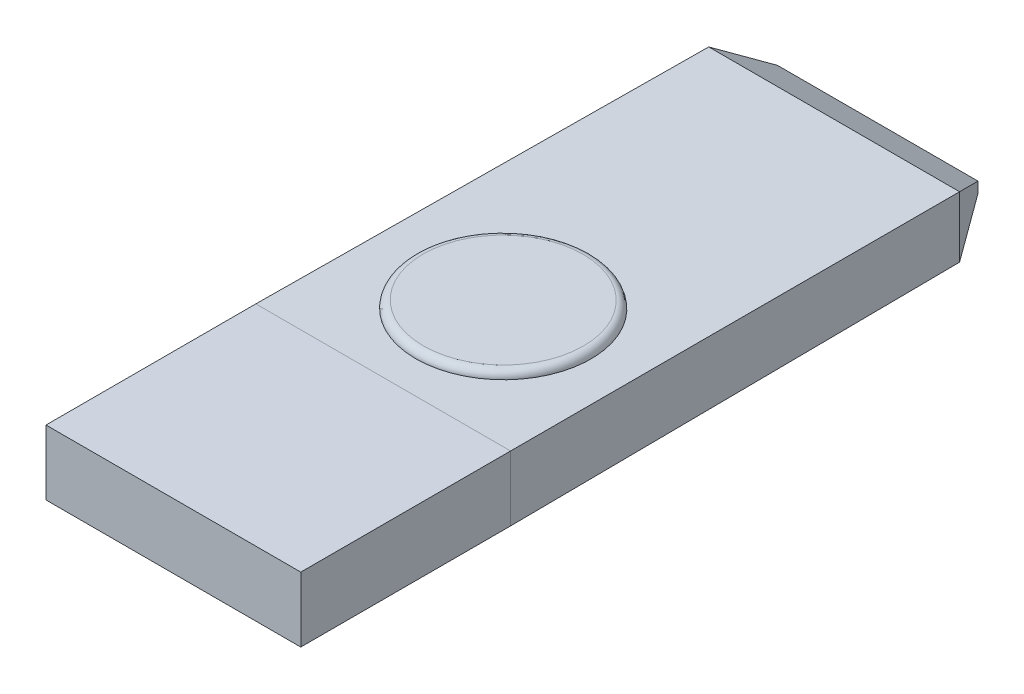
from build123d import *

# Parameters (mm, degrees)
SHIM_TOP_START          = -1.6
SHIM_SKETCH_W           = 10.2
SHIM_SKETCH_H           = 2.6
SHIM_TOP_DEPTH          = 8.4
SHIM_BOTTOM_OUTLINE_W   = 10.027211308
SHIM_BOTTOM_OUTLINE_H   = 2.427211308
SHIM_BOTTOM_DEPTH       = 19.8
SHIM_BOTTOM_DRAFT       = -0.25
CHAMFER_2_SIZE          = 1
CHAMFER_2_SIZE2         = 1.745257156
RETAINING_BUMP_SKETCH_R = 3.5
RETAINING_BUMP_DEPTH    = 0.3
FILLET1_R               = 0.3


# Read off the part's stored shape, not the designer's step: shim_bottom
with BuildPart() as part:
    # shim_sketch → shim_top (new body)
    with BuildSketch(Plane.XY.offset(SHIM_TOP_START)):
        with Locations((-242.85, 41.3)):
            Rectangle(SHIM_SKETCH_W, SHIM_SKETCH_H)
    extrude(amount=-SHIM_TOP_DEPTH)


with BuildPart() as shim_bottom_tool:
    # shim_bottom outline → shim_bottom (with draft: the straight prism first)
    with BuildSketch(Plane.XY.offset(-29.8)):
        with Locations((-242.85, 41.3)):
            Rectangle(SHIM_BOTTOM_OUTLINE_W, SHIM_BOTTOM_OUTLINE_H)
    extrude(amount=SHIM_BOTTOM_DEPTH)
    # shim_bottom: the draft: its side faces are tilted about the plane it starts from
    shim_bottom_sides = [shim_bottom_tool.faces().sort_by_distance(p)[0] for p in [
        (-242.85, 40.086394346, -19.9),
        (-237.836394346, 41.3, -19.9),
        (-242.85, 42.513605654, -19.9),
        (-247.863605654, 41.3, -19.9),
    ]]
    draft(shim_bottom_sides, Plane.XY.offset(-29.8), SHIM_BOTTOM_DRAFT)


with BuildPart() as part_1:
    add(part.part)

    # shim_bottom: add shim_bottom_tool
    add(shim_bottom_tool.part)

    # Chamfer 2
    chamfer_2_edges = [part_1.edges().sort_by_distance(p)[0] for p in [
        (-237.836394346, 41.3, -29.8),
        (-242.85, 42.513605654, -29.8),
        (-247.863605654, 41.3, -29.8),
        (-242.85, 40.086394346, -29.8),
    ]]
    chamfer_2_side = [part_1.faces().sort_by_distance(p)[0] for p in [
        (-242.85, 41.3, -29.8),
    ]]
    chamfer(chamfer_2_edges, length=CHAMFER_2_SIZE, length2=CHAMFER_2_SIZE2, reference=chamfer_2_side[0])

    # retaining_bump_sketch → retaining_bump (add)
    with BuildSketch(Plane(origin=(0, 42.642821639, -0.186065591), x_dir=(1, 0, 0), z_dir=(0, 0.9999904807207346, -0.004363309284746581))):
        with Locations(Location((-242.85, 14.618579624, 0), (0, 0, 270))):
            Circle(RETAINING_BUMP_SKETCH_R)
    extrude(amount=RETAINING_BUMP_DEPTH)

    # Fillet1
    fillet1_edges = [part_1.edges().sort_by_distance(p)[0] for p in [
        (-242.85, 42.863761816, -18.305781732),
    ]]
    fillet(fillet1_edges, radius=FILLET1_R - 0.0001)  # a hair under: the kernel refuses the full size


solid = part_1.part
